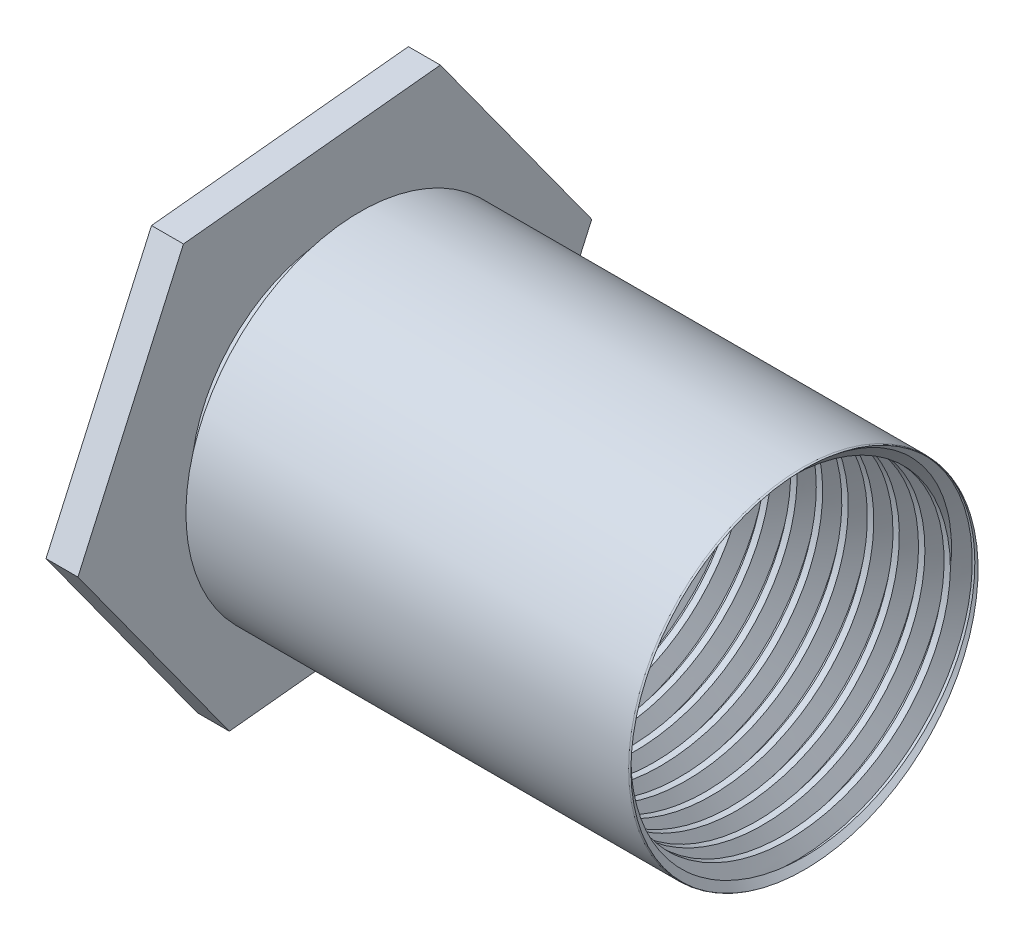
from build123d import *

# Parameters (mm, degrees)
BOSS_EXTRUDE1_DEPTH      = 1
M8_CLEARANCE_HOLE1_D     = 10
M8_CLEARANCE_HOLE1_DEPTH = 13.5
M8_CLEARANCE_HOLE1_TIP   = 2.886751346
CHAMFER1_SIZE            = 0.433
FILLET1_R                = 0.1
THREAD1_PITCH            = 0.8


with BuildPart() as part:
    # Sketch1 → Boss-Extrude1 (new body)
    with BuildSketch(Plane(origin=(0.3, 0, 0), x_dir=(0, 0, -1), z_dir=(1, 0, 0))):
        Polygon((8.040269412, 0.829096565), (3.302116019, 7.377625846), (-4.738153393, 6.548529282), (-8.040269412, -0.829096565), (-3.302116019, -7.377625846), (4.738153393, -6.548529282), align=None)
    extrude(amount=-BOSS_EXTRUDE1_DEPTH)

    # Sketch2 → Revolve1 (revolve)
    with BuildSketch(Plane(origin=(0, 0, 0), x_dir=(-1, 0, 0), z_dir=(0, 0, -1)), mode=Mode.PRIVATE) as revolve1_sk:
        Polygon((-15, 5.45), (-15, 0), (-0.3, 0), (-0.3, 4.5), (-1.09, 4.5), (-1.09, 5.45), align=None)
    revolve(revolve1_sk.sketch.rotate(Axis((15, 0, 0), (-1, 0, 0)), 180), axis=Axis((15, 0, 0), (-1, 0, 0)))

    # M8 Clearance Hole1
    with Locations(Plane(origin=(15, 0, 0), x_dir=(0, 0, -1), z_dir=(1, 0, 0))):
        with Locations((0, 0)):
            Hole(M8_CLEARANCE_HOLE1_D / 2, depth=M8_CLEARANCE_HOLE1_DEPTH)
            with Locations((0, 0, -(M8_CLEARANCE_HOLE1_DEPTH + M8_CLEARANCE_HOLE1_TIP / 2))):  # 120° drill point
                Cone(0, M8_CLEARANCE_HOLE1_D / 2, M8_CLEARANCE_HOLE1_TIP, mode=Mode.SUBTRACT)

    # Chamfer1
    chamfer1_edges = [part.edges().sort_by_distance(p)[0] for p in [
        (15, 0, -5),
    ]]
    chamfer(chamfer1_edges, length=CHAMFER1_SIZE)

    # Fillet1
    # the kernel refuses this fillet: 0.1 mm, written as the material it takes off along each edge
    with BuildSketch(Plane(origin=(15, 0, 0), x_dir=(0, -1, 0), z_dir=(0, 0, -1))) as fillet1_piece_1:
        with BuildLine():
            CenterArc((5.35, 0.055776339), FILLET1_R, 326.098738004, 33.901261996)
            Line((5.45, 0.055776339), (5.452, 0.055776339))
            Line((5.452, 0.055776339), (5.452, 0))
            Line((5.452, 0), (5.45, -0.002))
            ThreePointArc((5.45, -0.002), (5.4415, -0.002), (5.43466, -0.001115527))
            Line((5.43466, -0.001115527), (5.433, 0))
        make_face()
    revolve(axis=Axis((15, 0, 0), (-1, 0, 0)), mode=Mode.SUBTRACT)

    # Thread1: the profile of Thread Profile1 profile screwed along a right-hand helix of 16.875 turns, 8 arcs to a turn; built about Z, then put on its axis
    thread1_z = Axis((0, 0, 0), (0, 0, 1))
    thread1_corners = [(4.9997, 0, -0.000173205), (5.4330127, 0, 0.249999999), (5.4330127, 0, 0.349999999), (4.9997, 0, 0.600173203)]
    with BuildLine(mode=Mode.PRIVATE) as thread1_profile:
        Line(thread1_corners[0], thread1_corners[1])
        Line(thread1_corners[1], thread1_corners[2])
        Line(thread1_corners[2], thread1_corners[3])
        Line(thread1_corners[3], thread1_corners[0])
    thread1_cap = Face(thread1_profile.wire())
    thread1_turn_angles = [0, 22.5, 45, 67.5, 90, 112.5, 135, 157.5, 180, 202.5, 225, 247.5, 270, 292.5, 315, 337.5, 360]
    thread1_turn_weights = [1, 0.9238795325112867, 1, 0.9238795325112867, 1, 0.9238795325112867, 1, 0.9238795325112867, 1, 0.9238795325112867, 1, 0.9238795325112867, 1, 0.9238795325112867, 1, 0.9238795325112867, 1]
    thread1_turn_rails = [Edge.make_bspline([Vector(p[0], p[1], 0).rotate(thread1_z, thread1_turn_angles[k]) / thread1_turn_weights[k] + Vector(0, 0, p[2] + THREAD1_PITCH * thread1_turn_angles[k] / 360) for k in range(17)], [0, 0, 0, 1, 1, 2, 2, 3, 3, 4, 4, 5, 5, 6, 6, 7, 7, 8, 8, 8], 2, thread1_turn_weights) for p in thread1_corners]
    thread1_turn_sides = [Face.make_surface_from_curves(thread1_turn_rails[p[0]], thread1_turn_rails[p[1]]) for p in [(0, 1), (1, 2), (2, 3), (3, 0)]]
    thread1_last_angles = [5760, 5782.5, 5805, 5827.5, 5850, 5872.5, 5895, 5917.5, 5940, 5962.5, 5985, 6007.5, 6030, 6052.5, 6075]
    thread1_last_weights = [1, 0.9238795325112867, 1, 0.9238795325112867, 1, 0.9238795325112867, 1, 0.9238795325112867, 1, 0.9238795325112867, 1, 0.9238795325112867, 1, 0.9238795325112867, 1]
    thread1_last_rails = [Edge.make_bspline([Vector(p[0], p[1], 0).rotate(thread1_z, thread1_last_angles[k]) / thread1_last_weights[k] + Vector(0, 0, p[2] + THREAD1_PITCH * thread1_last_angles[k] / 360) for k in range(15)], [0, 0, 0, 1, 1, 2, 2, 3, 3, 4, 4, 5, 5, 6, 6, 7, 7, 7], 2, thread1_last_weights) for p in thread1_corners]
    thread1_last_sides = [Face.make_surface_from_curves(thread1_last_rails[p[0]], thread1_last_rails[p[1]]) for p in [(0, 1), (1, 2), (2, 3), (3, 0)]]
    thread1 = Plane(origin=(15.567, 0, 0), x_dir=(0, 0, 1), z_dir=(-1, 0, 0)) * Solid(Shell([*[p.moved(Location((0, 0, THREAD1_PITCH * i))) for i in range(16) for p in thread1_turn_sides], *thread1_last_sides, thread1_cap, thread1_cap.rotate(thread1_z, 6075).moved(Location((0, 0, THREAD1_PITCH * 6075 / 360)))]))
    add(thread1, mode=Mode.SUBTRACT)


solid = part.part
